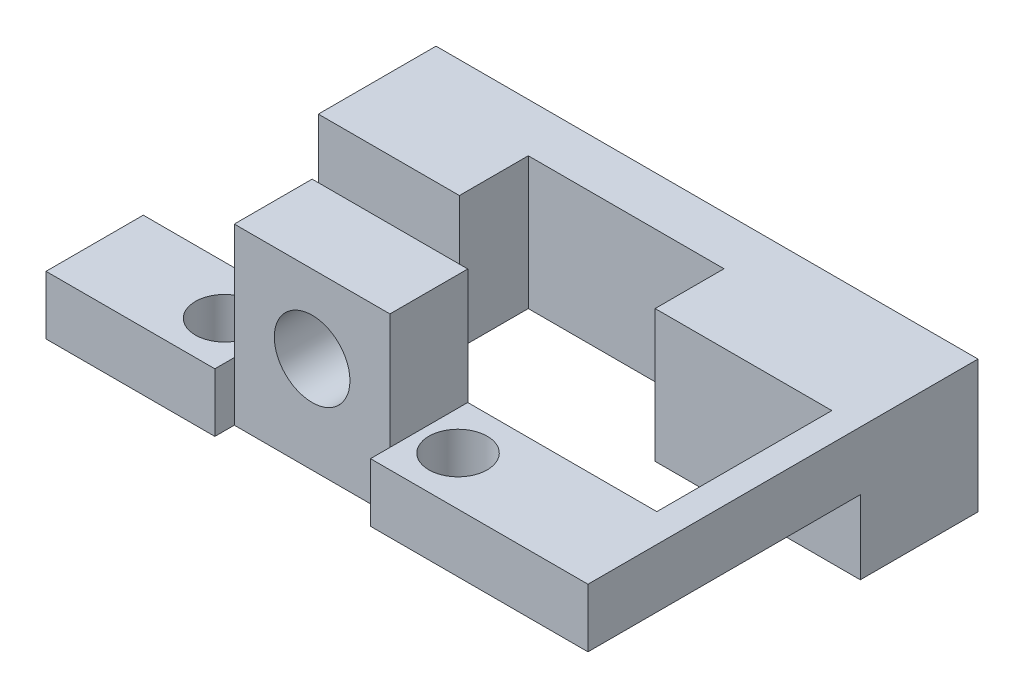
from build123d import *

# Parameters (mm, degrees)
SKETCH1_R                 = 1.943369714
BOSS_EXTRUDE1_DEPTH       = 5
SKETCH2_W                 = 5
SKETCH2_H                 = 3.011554738
BOSS_EXTRUDE2_DEPTH       = 3
SKETCH3_W                 = 5
SKETCH3_H                 = 3.011554738
BOSS_EXTRUDE3_DEPTH       = 1
BOSS_EXTRUDE4_DEPTH       = 15.45
BOSS_EXTRUDE5_DEPTH       = 5
BOSS_EXTRUDE6_REACH       = 91.127
SKETCH6_W                 = 4.39741832
SKETCH6_H                 = 3.011554738
SKETCH7_W                 = 27.232002546
SKETCH7_H                 = 1.691876565
BOSS_EXTRUDE7_DEPTH       = 3.011555
CUT_EXTRUDE1_DEPTH        = 1.691877
SKETCH10_R                = 1.5
CUT_EXTRUDE2_DEPTH        = 5
CUT_EXTRUDE3_DEPTH        = 5
SKETCH12_W                = 7.087819815
SKETCH12_H                = 5.363231601
SKETCH12_W_2              = 7.084410937
BOSS_EXTRUDE8_DEPTH       = 3.011555
SKETCH13_R                = 1.5
CUT_EXTRUDE4_DEPTH        = 5
BOSS_EXTRUDE9_START       = -5.000001
BOSS_EXTRUDE9_DEPTH       = 5.000002
SKETCH15_R                = 1.5
BOSS_EXTRUDE10_DEPTH      = 3.011554738
CUT_EXTRUDE6_DEPTH        = 3.011555
BOSS_EXTRUDE11_START      = 1
BOSS_EXTRUDE11_DEPTH      = 1
CUT_EXTRUDE7_DEPTH        = 4
SKETCH21_R                = 1.5
CUT_EXTRUDE8_DEPTH        = 4
CUT_EXTRUDE9_DEPTH        = 1
BOSS_EXTRUDE12_START      = -13.37096588
BOSS_EXTRUDE12_DEPTH      = 4.373492366
BOSS_EXTRUDE13_DEPTH      = 1.68162
SKETCH30_W                = 13.059771794
SKETCH30_H                = 2.186746183
CUT_EXTRUDE10_DEPTH       = 10
SKETCH31_W                = 13.059771794
SKETCH31_H                = 2.186746183
BOSS_EXTRUDE14_DEPTH      = 2.793186
SKETCH32_W                = 27.857200393
SKETCH32_H                = 1.676275872
BOSS_EXTRUDE15_DEPTH      = 5.803619
SKETCH33_W                = 13.059771794
SKETCH33_H                = 1.354144498
CUT_EXTRUDE11_DEPTH       = 5.804742
BOSS_EXTRUDE16_DEPTH      = 0.832602
SKETCH35_W                = 2
SKETCH35_H                = 3.540890681
BOSS_EXTRUDE17_DEPTH      = 5.809427
SKETCH36_W                = 1
SKETCH36_H                = 3.540890681
BOSS_EXTRUDE18_DEPTH      = 5.80474
BOSS_EXTRUDE20_DEPTH      = 2
BOSS_EXTRUDE20_DEPTH_BACK = 2
CUT_EXTRUDE12_DEPTH       = 1


# Read off the part's stored shape, not the designer's step: Boss-Extrude12
with BuildPart() as part:
    # Sketch1 → Boss-Extrude1 (new body)
    with BuildSketch(Plane.XY):
        with BuildLine():
            Line((-105.90797469, 75.375672325), (-114.442913217, 75.375672325))
            Line((-114.442913217, 75.375672325), (-114.442913217, 72.364117587))
            Line((-114.442913217, 72.364117587), (-88.233212536, 72.364117587))
            Line((-88.233212536, 72.364117587), (-88.233212536, 75.375672325))
            Line((-88.233212536, 75.375672325), (-98.915825857, 75.375672325))
            ThreePointArc((-98.915825857, 75.375672325), (-102.411900273, 81.318944809), (-105.90797469, 75.375672325))
        make_face()
        with Locations((-102.411900273, 77.319042039)):
            Circle(SKETCH1_R, mode=Mode.SUBTRACT)
    extrude(amount=BOSS_EXTRUDE1_DEPTH)

    # Sketch2 → Boss-Extrude2 (add)
    with BuildSketch(Plane.ZY.offset(114.442913217)):
        with Locations((2.5, 73.869894956)):
            Rectangle(SKETCH2_W, SKETCH2_H)
    extrude(amount=BOSS_EXTRUDE2_DEPTH)

    # Sketch3 → Boss-Extrude3 (add)
    with BuildSketch(Plane(origin=(-88.233212536, 0, 0), x_dir=(0, 0, -1), z_dir=(1, 0, 0))):
        with Locations((-2.5, 73.869894956)):
            Rectangle(SKETCH3_W, SKETCH3_H)
    extrude(amount=BOSS_EXTRUDE3_DEPTH)

    # Sketch4 → Boss-Extrude4 (add)
    with BuildSketch(Plane(origin=(0, 0, 0), x_dir=(-1, 0, 0), z_dir=(0, 0, -1))):
        Polygon((89.234854516, 72.364117587), (87.233212536, 72.364117587), (87.233212536, 75.375672325), (88.695072503, 75.375672325), align=None)
        Polygon((117.442913217, 75.375672325), (117.442913217, 72.364117587), (115.090412929, 72.364117587), (115.927075049, 75.375672325), align=None)
    extrude(amount=BOSS_EXTRUDE4_DEPTH)

    # Sketch5 → Boss-Extrude5 (add)
    with BuildSketch(Plane(origin=(0, 0, -15.45), x_dir=(-1, 0, 0), z_dir=(0, 0, -1))):
        Polygon((89.234854516, 72.364117587), (88.695072503, 75.375672325), (87.233212536, 75.375672325), (87.233212536, 72.364117587), align=None)
        Polygon((117.442913217, 72.364117587), (117.442913217, 75.375672325), (115.927075049, 75.375672325), (115.090412929, 72.364117587), align=None)
    extrude(amount=BOSS_EXTRUDE5_DEPTH)

    # Boss-Extrude6: up to this plane
    boss_extrude6_end = Plane(origin=(-115.927075049, 75.375672325, -19.271481329), z_dir=(-0.9635080795452587, -0.2676792495712127, 0))
    # Sketch6 → Boss-Extrude6 (add, up to the surface)
    with BuildSketch(Plane(origin=(-87.233212536, 0, 0), x_dir=(0, 0, -1), z_dir=(1, 0, 0)), mode=Mode.PRIVATE) as boss_extrude6_sk1:
        with Locations((18.25129084, 73.869894956)):
            Rectangle(SKETCH6_W, SKETCH6_H)
    boss_extrude6_tool1 = split(extrude(boss_extrude6_sk1.sketch, amount=-BOSS_EXTRUDE6_REACH, mode=Mode.PRIVATE), bisect_by=boss_extrude6_end, keep=Keep.BOTH, mode=Mode.PRIVATE)
    add(boss_extrude6_tool1.solids().sort_by_distance((-87.233213, 73.869895, -18.251291))[0])

    # Sketch7 → Boss-Extrude7 (add)
    with BuildSketch(Plane(origin=(0, 75.375672325, 0), x_dir=(1, 0, 0), z_dir=(0, 1, 0))):
        with Locations((-102.311073776, 9.843411796)):
            Rectangle(SKETCH7_W, SKETCH7_H)
    extrude(amount=-BOSS_EXTRUDE7_DEPTH)

    # Sketch9 → Cut-Extrude1 (cut)
    with BuildSketch(Plane(origin=(0, 0, -10.689350079), x_dir=(-1, 0, 0), z_dir=(0, 0, -1))):
        with BuildLine():
            Line((100.39939301, 75.375672325), (104.391873417, 75.375672325))
            ThreePointArc((104.391873417, 75.375672325), (102.395633214, 75.079709627), (100.39939301, 75.375672325))
        make_face()
    extrude(amount=-CUT_EXTRUDE1_DEPTH, mode=Mode.SUBTRACT)

    # Sketch10 → Cut-Extrude2 (cut)
    with BuildSketch(Plane(origin=(0, 75.375672325, 0), x_dir=(1, 0, 0), z_dir=(0, 1, 0))):
        with Locations(Location((-102.389399958, 18.296933794, 0), (0, 0, 270))):
            Circle(SKETCH10_R)
        with Locations(Location((-114.196864357, -2.469689872, 0), (0, 0, 270))):
            Circle(SKETCH10_R)
        with Locations(Location((-90.467618586, -2.570513513, 0), (0, 0, 270))):
            Circle(SKETCH10_R)
    extrude(amount=-CUT_EXTRUDE2_DEPTH, mode=Mode.SUBTRACT)

    # Sketch11 → Cut-Extrude3 (cut)
    with BuildSketch(Plane(origin=(0, 75.375672325, 0), x_dir=(1, 0, 0), z_dir=(0, 1, 0))):
        Polygon((-87.233212536, 20.45), (-115.927075049, 20.45), (-117.442913217, 20.45), (-117.442913217, 16.05258168), (-115.927075049, 16.05258168), (-87.233212536, 16.05258168), align=None)
    extrude(amount=-CUT_EXTRUDE3_DEPTH, mode=Mode.SUBTRACT)

    # Sketch12 → Boss-Extrude8 (add)
    with BuildSketch(Plane(origin=(0, 75.375672325, 0), x_dir=(1, 0, 0), z_dir=(0, 1, 0))):
        with Locations((-112.383165142, 13.370965879)):
            Rectangle(SKETCH12_W, SKETCH12_H)
        with Locations((-92.237277972, 13.370965879)):
            Rectangle(SKETCH12_W_2, SKETCH12_H)
    extrude(amount=-BOSS_EXTRUDE8_DEPTH)

    # Sketch13 → Cut-Extrude4 (cut)
    with BuildSketch(Plane(origin=(0, 75.375672325, 0), x_dir=(1, 0, 0), z_dir=(0, 1, 0))):
        with Locations(Location((-91.387861774, 12.69615807, 0), (0, 0, 270))):
            Circle(SKETCH13_R)
        with Locations(Location((-112.880960362, 12.852813307, 0), (0, 0, 270))):
            Circle(SKETCH13_R)
    extrude(amount=-CUT_EXTRUDE4_DEPTH, mode=Mode.SUBTRACT)

    # Sketch14 → Boss-Extrude9 (add)
    with BuildSketch(Plane.XY.offset(5).offset(BOSS_EXTRUDE9_START)):
        with BuildLine():
            Line((-102.411900273, 81.318944809), (-106.411803043, 81.318944809))
            Line((-106.411803043, 81.318944809), (-106.411803043, 77.319042039))
            ThreePointArc((-106.411803043, 77.319042039), (-105.240258646, 80.147400412), (-102.411900273, 81.318944809))
        make_face()
        with BuildLine():
            ThreePointArc((-105.90797469, 75.375672325), (-106.283797735, 76.315233186), (-106.411803043, 77.319042039))
            Line((-106.411803043, 77.319042039), (-106.411803043, 75.375672325))
            Line((-106.411803043, 75.375672325), (-105.90797469, 75.375672325))
        make_face()
        with BuildLine():
            Line((-98.411997503, 81.318944809), (-102.411900273, 81.318944809))
            ThreePointArc((-102.411900273, 81.318944809), (-99.583541901, 80.147400412), (-98.411997503, 77.319042039))
            Line((-98.411997503, 77.319042039), (-98.411997503, 81.318944809))
        make_face()
        with BuildLine():
            Line((-98.411997503, 75.375672325), (-98.411997503, 77.319042039))
            ThreePointArc((-98.411997503, 77.319042039), (-98.540002811, 76.315233186), (-98.915825857, 75.375672325))
            Line((-98.915825857, 75.375672325), (-98.411997503, 75.375672325))
        make_face()
    extrude(amount=BOSS_EXTRUDE9_DEPTH)

    # Sketch15 → Boss-Extrude10 (add)
    with BuildSketch(Plane(origin=(0, 75.375672325, 0), x_dir=(1, 0, 0), z_dir=(0, 1, 0))):
        with Locations((-114.196864357, -2.469689872)):
            Circle(SKETCH15_R)
        with Locations((-90.467618586, -2.570513513)):
            Circle(SKETCH15_R)
        with Locations((-91.387861774, 12.69615807)):
            Circle(SKETCH15_R)
        with Locations((-112.880960362, 12.852813307)):
            Circle(SKETCH15_R)
    extrude(amount=-BOSS_EXTRUDE10_DEPTH)

    # Sketch17 → Cut-Extrude6 (cut)
    with BuildSketch(Plane(origin=(0, 75.375672325, 0), x_dir=(1, 0, 0), z_dir=(0, 1, 0))):
        Polygon((-108.839255234, 13.37096588), (-117.442913217, 13.37096588), (-117.442913217, 16.05258168), (-87.233212536, 16.05258168), (-87.233212536, 13.37096588), (-95.77948344, 13.37096588), align=None)
    extrude(amount=-CUT_EXTRUDE6_DEPTH, mode=Mode.SUBTRACT)

    # Sketch19 → Boss-Extrude11 (add)
    with BuildSketch(Plane(origin=(0, 0, -10.689350079), x_dir=(-1, 0, 0), z_dir=(0, 0, -1)).offset(BOSS_EXTRUDE11_START)):
        with BuildLine():
            Line((95.77948344, 75.375672325), (95.77948344, 72.364117587))
            Line((95.77948344, 72.364117587), (108.839255234, 72.364117587))
            Line((108.839255234, 72.364117587), (108.839255234, 75.375672325))
            Line((108.839255234, 75.375672325), (104.391873417, 75.375672325))
            ThreePointArc((104.391873417, 75.375672325), (102.395633214, 75.079709627), (100.39939301, 75.375672325))
            Line((100.39939301, 75.375672325), (95.77948344, 75.375672325))
        make_face()
    extrude(amount=-BOSS_EXTRUDE11_DEPTH)

    # Sketch20 → Cut-Extrude7 (cut)
    with BuildSketch(Plane.XZ.offset(-72.364117587)):
        Polygon((-117.442913217, -13.37096588), (-115.090412929, -13.37096588), (-115.090412929, 0), (-115.090412929, 5), (-117.442913217, 5), (-117.442913217, 0), align=None)
    extrude(amount=-CUT_EXTRUDE7_DEPTH, mode=Mode.SUBTRACT)

    # Sketch21 → Cut-Extrude8 (cut)
    with BuildSketch(Plane(origin=(0, 75.375672325, 0), x_dir=(1, 0, 0), z_dir=(0, 1, 0))):
        with Locations(Location((-96.411997503, -2.5, 0), (0, 0, 270))):
            Circle(SKETCH21_R)
        with Locations(Location((-108.411803043, -2.5, 0), (0, 0, 270))):
            Circle(SKETCH21_R)
    extrude(amount=-CUT_EXTRUDE8_DEPTH, mode=Mode.SUBTRACT)

    # Sketch22 → Cut-Extrude9 (cut)
    with BuildSketch(Plane.XY.offset(5)):
        Polygon((-106.411803043, 75.375672325), (-106.411803043, 72.364117587), (-98.411997503, 72.364117587), (-98.411997503, 75.375672325), (-98.411997503, 81.318944809), (-106.411803043, 81.318944809), align=None)
    extrude(amount=-CUT_EXTRUDE9_DEPTH, mode=Mode.SUBTRACT)


with BuildPart() as cut_extrude9_kept_piece:
    # of the separate pieces the step leaves, the one the design keeps (cut_extrude9_pieces_kept)
    add(part.part.solids().sort_by_distance((-106.411803043, 75.375672325, 0))[0])

    # Boss-Extrude12 outline → Boss-Extrude12 (add)
    with BuildSketch(Plane.XY.offset(BOSS_EXTRUDE12_START)):
        Polygon((-95.77948344, 69.566245358), (-87.233212536, 69.56317843), (-87.233212536, 72.364117587), (-95.77948344, 72.364117587), align=None)
        Polygon((-108.839255234, 69.570932009), (-108.839255234, 72.364117587), (-115.090412929, 72.364117587), (-115.090412929, 69.57317531), align=None)
    extrude(amount=BOSS_EXTRUDE12_DEPTH)

    # Sketch26 → Boss-Extrude13 (add)
    with BuildSketch(Plane(origin=(0, 0, -11.689350079), x_dir=(-1, 0, 0), z_dir=(0, 0, -1))):
        with BuildLine():
            Line((100.39939301, 75.375672325), (95.77948344, 75.375672325))
            Line((95.77948344, 75.375672325), (95.77948344, 72.364117587))
            Line((95.77948344, 72.364117587), (108.839255234, 72.364117587))
            Line((108.839255234, 72.364117587), (108.839255234, 75.375672325))
            Line((108.839255234, 75.375672325), (104.391873417, 75.375672325))
            ThreePointArc((104.391873417, 75.375672325), (102.395633214, 75.079709627), (100.39939301, 75.375672325))
        make_face()
    extrude(amount=BOSS_EXTRUDE13_DEPTH)

    # Sketch30 → Cut-Extrude10 (cut)
    with BuildSketch(Plane(origin=(0, 75.375672325, 0), x_dir=(1, 0, 0), z_dir=(0, 1, 0))):
        with Locations((-102.309369337, 10.090846606)):
            Rectangle(SKETCH30_W, SKETCH30_H)
    extrude(amount=-CUT_EXTRUDE10_DEPTH, mode=Mode.SUBTRACT)

    # Sketch31 → Boss-Extrude14 (add)
    with BuildSketch(Plane.XZ.offset(-72.364117587)):
        with Locations((-102.309369337, -12.277592789)):
            Rectangle(SKETCH31_W, SKETCH31_H)
    extrude(amount=BOSS_EXTRUDE14_DEPTH)

    # Sketch32 → Boss-Extrude15 (add)
    with BuildSketch(Plane(origin=(0, 75.375672325, 0), x_dir=(1, 0, 0), z_dir=(0, 1, 0))):
        with Locations((-101.161812733, 14.209103816)):
            Rectangle(SKETCH32_W, SKETCH32_H)
    extrude(amount=-BOSS_EXTRUDE15_DEPTH)

    # Sketch33 → Cut-Extrude11 (cut)
    with BuildSketch(Plane(origin=(0, 75.375672325, 0), x_dir=(1, 0, 0), z_dir=(0, 1, 0))):
        with Locations((-102.309369337, 11.861291946)):
            Rectangle(SKETCH33_W, SKETCH33_H)
    extrude(amount=-CUT_EXTRUDE11_DEPTH, mode=Mode.SUBTRACT)

    # Sketch34 → Boss-Extrude16 (add)
    with BuildSketch(Plane.XY.offset(-13.37096588)):
        with BuildLine():
            Line((-100.39939301, 75.375672325), (-104.391873417, 75.375672325))
            ThreePointArc((-104.391873417, 75.375672325), (-102.395633214, 75.079709627), (-100.39939301, 75.375672325))
        make_face()
    extrude(amount=BOSS_EXTRUDE16_DEPTH)

    # Sketch35 → Boss-Extrude17 (add)
    with BuildSketch(Plane(origin=(0, 75.375672325, 0), x_dir=(1, 0, 0), z_dir=(0, 1, 0))):
        with Locations((-96.77948344, 10.767918855)):
            Rectangle(SKETCH35_W, SKETCH35_H)
    extrude(amount=-BOSS_EXTRUDE17_DEPTH)

    # Sketch36 → Boss-Extrude18 (add)
    with BuildSketch(Plane(origin=(0, 75.375672325, 0), x_dir=(1, 0, 0), z_dir=(0, 1, 0))):
        with Locations((-108.339255234, 10.767918855)):
            Rectangle(SKETCH36_W, SKETCH36_H)
    extrude(amount=-BOSS_EXTRUDE18_DEPTH)

    # Sketch37 → Boss-Extrude20 (add, two sides: drawn at the far end of the back side and taken through both)
    with BuildSketch(Plane.XZ.offset(-69.57205366).offset(-BOSS_EXTRUDE20_DEPTH_BACK)):
        Polygon((-115.090412929, -15.047241752), (-115.090412929, -8.997473514), (-107.839255234, -8.997473514), (-107.839255234, -12.538364195), (-97.77948344, -12.538364195), (-97.77948344, -8.997473514), (-87.233212536, -8.997473514), (-87.233212536, -15.047241752), align=None)
    extrude(amount=BOSS_EXTRUDE20_DEPTH + BOSS_EXTRUDE20_DEPTH_BACK)

    # Sketch39 → Cut-Extrude12 (cut)
    with BuildSketch(Plane.XZ.offset(-67.57205366)):
        Polygon((-115.090412929, -15.047241752), (-87.233212536, -15.047241752), (-87.233212536, -8.997473514), (-97.77948344, -8.997473514), (-97.77948344, -12.538364195), (-107.839255234, -12.538364195), (-107.839255234, -8.997473514), (-115.090412929, -8.997473514), align=None)
    extrude(amount=-CUT_EXTRUDE12_DEPTH, mode=Mode.SUBTRACT)


solid = cut_extrude9_kept_piece.part
